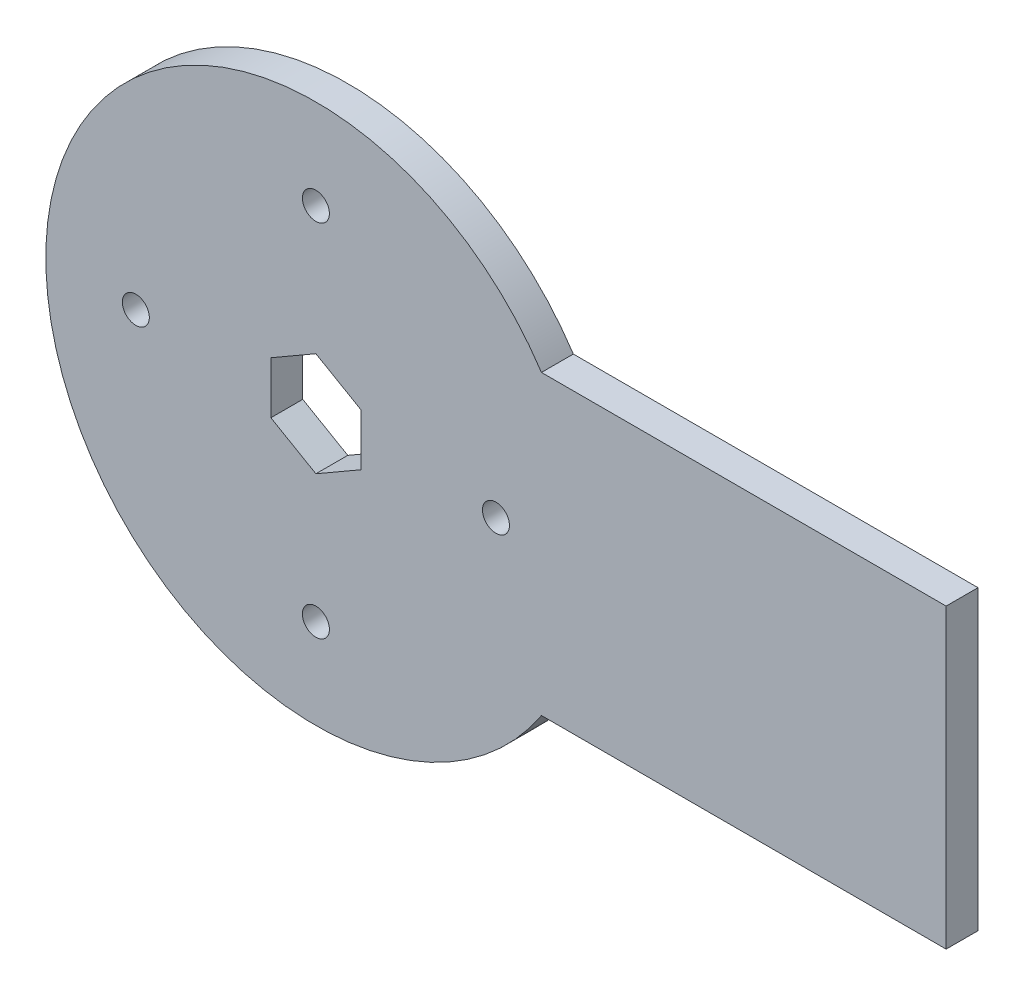
from build123d import *

# Parameters (mm, degrees)
SKETCH1_R           = 30
BOSS_EXTRUDE1_DEPTH = 3.54
BOSS_EXTRUDE4_START = -3.54
BOSS_EXTRUDE4_DEPTH = 3.54
CUT_EXTRUDE3_DEPTH  = 6
SKETCH10_R          = 1.5
CUT_EXTRUDE4_DEPTH  = 10


with BuildPart() as part:
    # Sketch1 → Boss-Extrude1 (new body)
    with BuildSketch(Plane.XY):
        Circle(SKETCH1_R)
    extrude(amount=BOSS_EXTRUDE1_DEPTH)

    # Sketch4 → Boss-Extrude4 (add)
    with BuildSketch(Plane.XY.offset(3.54).offset(BOSS_EXTRUDE4_START)):
        with BuildLine():
            Line((25.054939633, 16.5), (70, 16.5))
            Line((70, 16.5), (70, -16.5))
            Line((70, -16.5), (25.054939633, -16.5))
            ThreePointArc((25.054939633, -16.5), (30, 0), (25.054939633, 16.5))
        make_face()
    extrude(amount=BOSS_EXTRUDE4_DEPTH)

    # Sketch9 → Cut-Extrude3 (cut)
    with BuildSketch(Plane(origin=(0, 0, 0), x_dir=(-1, 0, 0), z_dir=(0, 0, -1))):
        Polygon((0, 5.773502692), (-5, 2.886751346), (-5, -2.886751346), (0, -5.773502692), (5, -2.886751346), (5, 2.886751346), align=None)
    extrude(amount=-CUT_EXTRUDE3_DEPTH, mode=Mode.SUBTRACT)

    # Sketch10 → Cut-Extrude4 (cut)
    with BuildSketch(Plane.XY.offset(3.54)):
        with Locations((0, 20)):
            Circle(SKETCH10_R)
        with Locations((20, 0)):
            Circle(SKETCH10_R)
        with Locations((0, -20)):
            Circle(SKETCH10_R)
        with Locations((-20, 0)):
            Circle(SKETCH10_R)
    extrude(amount=-CUT_EXTRUDE4_DEPTH, mode=Mode.SUBTRACT)


solid = part.part
